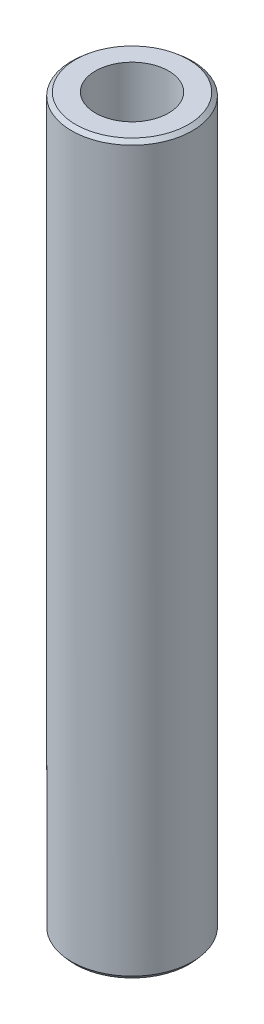
from build123d import *
from OCP.BRepFilletAPI import BRepFilletAPI_MakeChamfer

# Parameters (mm, degrees)
SKETCH1_R           = 12.5
BOSS_EXTRUDE1_DEPTH = 150.466788726
SKETCH2_R           = 7.56721321
CUT_EXTRUDE1_DEPTH  = 152.501665038
CHAMFER1_SIZE       = 0.707327099
CHAMFER1_SIZE2      = 0.829926351


with BuildPart() as part:
    # Sketch1 → Boss-Extrude1 (new body)
    with BuildSketch(Plane(origin=(0, 0, 0), x_dir=(1, 0, 0), z_dir=(0, 1, 0))):
        Circle(SKETCH1_R)
    extrude(amount=BOSS_EXTRUDE1_DEPTH)

    # Sketch2 → Cut-Extrude1 (cut, through all)
    with BuildSketch(Plane(origin=(0, 0, 0), x_dir=(1, 0, 0), z_dir=(0, 1, 0))):
        Circle(SKETCH2_R)
    extrude(amount=CUT_EXTRUDE1_DEPTH, mode=Mode.SUBTRACT)

    # Chamfer1: one chamfer whose edges measure the first distance from different faces: ONE call of the kernel's chamfer builder (chamfer() names one face for all edges)
    chamfer1_edges_1 = [part.edges().sort_by_distance(p)[0] for p in [
        (-12.5, 150.466788726, 0),
    ]]
    chamfer1_side_1 = [part.faces().sort_by_distance(p)[0] for p in [
        (-12.5, 75.233394363, 0),
    ]]
    chamfer1_edges_2 = [part.edges().sort_by_distance(p)[0] for p in [
        (-12.5, 0, 0),
    ]]
    chamfer1_side_2 = [part.faces().sort_by_distance(p)[0] for p in [
        (-12.146446609, 0, 0),
    ]]
    chamfer1 = BRepFilletAPI_MakeChamfer(part.part.solid().wrapped)
    for e in chamfer1_edges_1:
        chamfer1.Add(CHAMFER1_SIZE, CHAMFER1_SIZE2, e.wrapped, chamfer1_side_1[0].wrapped)  # the first distance lies on this face
    for e in chamfer1_edges_2:
        chamfer1.Add(CHAMFER1_SIZE, CHAMFER1_SIZE2, e.wrapped, chamfer1_side_2[0].wrapped)  # the first distance lies on this face
    add(Compound.cast(chamfer1.Shape()), mode=Mode.REPLACE)


solid = part.part
